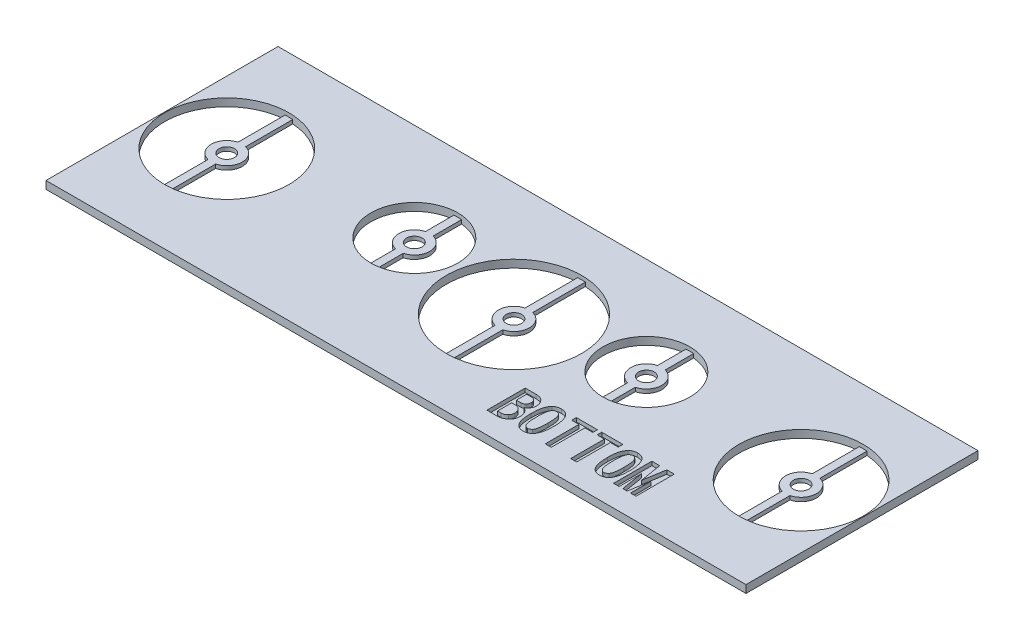
from build123d import *

# Parameters (mm, degrees)
SKETCH2_W           = 181
SKETCH2_H           = 60
SKETCH2_R           = 11.25
SKETCH2_R_2         = 16.08
SKETCH2_R_3         = 17.5
BOSS_EXTRUDE1_DEPTH = 2
BOSS_EXTRUDE2_START = -2
SKETCH3_R           = 2
BOSS_EXTRUDE2_DEPTH = 2
CUT_EXTRUDE1_START  = -1
CUT_EXTRUDE1_DEPTH  = 1
CUT_EXTRUDE2_START  = -1
SKETCH5_R           = 11.25
SKETCH5_R_2         = 16.08
SKETCH5_R_3         = 17.5
CUT_EXTRUDE2_DEPTH  = 1


# Read off the part's stored shape, not the designer's step: Cut-Extrude1
with BuildPart() as part:
    # Sketch2 → Boss-Extrude1 (new body)
    with BuildSketch(Plane(origin=(0, 0, 0), x_dir=(1, 0, 0), z_dir=(0, 1, 0))):
        with Locations((0, -4.75)):
            Rectangle(SKETCH2_W, SKETCH2_H)
        with Locations(Location((-30, 0, 0), (0, 0, 270))):
            Circle(SKETCH2_R, mode=Mode.SUBTRACT)
        with Locations(Location((30, 0, 0), (0, 0, 270))):
            Circle(SKETCH2_R, mode=Mode.SUBTRACT)
        with Locations(Location((-74.25, -4.25, 0), (0, 0, 270))):
            Circle(SKETCH2_R_2, mode=Mode.SUBTRACT)
        with Locations(Location((0, -4.25, 0), (0, 0, 270))):
            Circle(SKETCH2_R_3, mode=Mode.SUBTRACT)
        with Locations(Location((74.25, -4.25, 0), (0, 0, 90))):
            Circle(SKETCH2_R_2, mode=Mode.SUBTRACT)
    extrude(amount=BOSS_EXTRUDE1_DEPTH)

    # Sketch3 → Boss-Extrude2 (add)
    # profile 1 of 5: a face of its own
    with BuildSketch(Plane(origin=(0, 2, 0), x_dir=(1, 0, 0), z_dir=(0, 1, 0)).offset(BOSS_EXTRUDE2_START)):
        with BuildLine():
            Line((-75.25, -20.29887535), (-75.25, -8.122983346))
            ThreePointArc((-75.25, -8.122983346), (-78.25, -4.25), (-75.25, -0.377016654))
            Line((-75.25, -0.377016654), (-75.25, 11.79887535))
            ThreePointArc((-75.25, 11.79887535), (-74.25, 11.83), (-73.25, 11.79887535))
            Line((-73.25, 11.79887535), (-73.25, -0.377016654))
            ThreePointArc((-73.25, -0.377016654), (-70.25, -4.25), (-73.25, -8.122983346))
            Line((-73.25, -8.122983346), (-73.25, -20.29887535))
            ThreePointArc((-73.25, -20.29887535), (-74.25, -20.33), (-75.25, -20.29887535))
        make_face()
        with Locations(Location((-74.25, -4.25, 0), (0, 0, 270))):
            Circle(SKETCH3_R, mode=Mode.SUBTRACT)
    # profile 2 of 5: a face of its own
    with BuildSketch(Plane(origin=(0, 2, 0), x_dir=(1, 0, 0), z_dir=(0, 1, 0)).offset(BOSS_EXTRUDE2_START)):
        with BuildLine():
            Line((73.25, 11.79887535), (73.25, -0.377016654))
            ThreePointArc((73.25, -0.377016654), (70.25, -4.25), (73.25, -8.122983346))
            Line((73.25, -8.122983346), (73.25, -20.29887535))
            ThreePointArc((73.25, -20.29887535), (74.25, -20.33), (75.25, -20.29887535))
            Line((75.25, -20.29887535), (75.25, -8.122983346))
            ThreePointArc((75.25, -8.122983346), (78.25, -4.25), (75.25, -0.377016654))
            Line((75.25, -0.377016654), (75.25, 11.79887535))
            ThreePointArc((75.25, 11.79887535), (74.25, 11.83), (73.25, 11.79887535))
        make_face()
        with Locations(Location((74.25, -4.25, 0), (0, 0, 270))):
            Circle(SKETCH3_R, mode=Mode.SUBTRACT)
    # profile 3 of 5: a face of its own
    with BuildSketch(Plane(origin=(0, 2, 0), x_dir=(1, 0, 0), z_dir=(0, 1, 0)).offset(BOSS_EXTRUDE2_START)):
        with BuildLine():
            Line((-31, 11.205467416), (-31, 3.872983346))
            ThreePointArc((-31, 3.872983346), (-34, 0), (-31, -3.872983346))
            Line((-31, -3.872983346), (-31, -11.205467416))
            ThreePointArc((-31, -11.205467416), (-30, -11.25), (-29, -11.205467416))
            Line((-29, -11.205467416), (-29, -3.872983346))
            ThreePointArc((-29, -3.872983346), (-26, 0), (-29, 3.872983346))
            Line((-29, 3.872983346), (-29, 11.205467416))
            ThreePointArc((-29, 11.205467416), (-30, 11.25), (-31, 11.205467416))
        make_face()
        with Locations(Location((-30, 0, 0), (0, 0, 270))):
            Circle(SKETCH3_R, mode=Mode.SUBTRACT)
    # profile 4 of 5: a face of its own
    with BuildSketch(Plane(origin=(0, 2, 0), x_dir=(1, 0, 0), z_dir=(0, 1, 0)).offset(BOSS_EXTRUDE2_START)):
        with BuildLine():
            Line((29, -11.205467416), (29, -3.872983346))
            ThreePointArc((29, -3.872983346), (26, 0), (29, 3.872983346))
            Line((29, 3.872983346), (29, 11.205467416))
            ThreePointArc((29, 11.205467416), (30, 11.25), (31, 11.205467416))
            Line((31, 11.205467416), (31, 3.872983346))
            ThreePointArc((31, 3.872983346), (34, 0), (31, -3.872983346))
            Line((31, -3.872983346), (31, -11.205467416))
            ThreePointArc((31, -11.205467416), (30, -11.25), (29, -11.205467416))
        make_face()
        with Locations(Location((30, 0, 0), (0, 0, 270))):
            Circle(SKETCH3_R, mode=Mode.SUBTRACT)
    # profile 5 of 5: a face of its own
    with BuildSketch(Plane(origin=(0, 2, 0), x_dir=(1, 0, 0), z_dir=(0, 1, 0)).offset(BOSS_EXTRUDE2_START)):
        with BuildLine():
            Line((-1, 13.22140521), (-1, -0.377016654))
            ThreePointArc((-1, -0.377016654), (-4, -4.25), (-1, -8.122983346))
            Line((-1, -8.122983346), (-1, -21.72140521))
            ThreePointArc((-1, -21.72140521), (0, -21.75), (1, -21.72140521))
            Line((1, -21.72140521), (1, -8.122983346))
            ThreePointArc((1, -8.122983346), (4, -4.25), (1, -0.377016654))
            Line((1, -0.377016654), (1, 13.22140521))
            ThreePointArc((1, 13.22140521), (0, 13.25), (-1, 13.22140521))
        make_face()
        with Locations(Location((0, -4.25, 0), (0, 0, 270))):
            Circle(SKETCH3_R, mode=Mode.SUBTRACT)
    extrude(amount=BOSS_EXTRUDE2_DEPTH)

    # Cut-Extrude1 outline → Cut-Extrude1 (cut)
    # profile 1 of 6: a face of its own
    with BuildSketch(Plane(origin=(0, 2, 0), x_dir=(1, 0, 0), z_dir=(0, 1, 0)).offset(CUT_EXTRUDE1_START)):
        with BuildLine():
            add(Edge.make_bspline(
                [(47.006980667, -19.276596347), (47.098634088, -19.27876699), (47.277526109, -19.28300372), (47.538214081, -19.315468508), (47.785587748, -19.367284932), (48.018908636, -19.442222462), (48.239532457, -19.537103963), (48.443976908, -19.656603341), (48.636551525, -19.794534033), (48.751992232, -19.902448172), (48.810044942, -19.956715928)],
                knots=[0, 0, 0, 0, 0.138875744, 0.271062029, 0.397512175, 0.521399598, 0.641877707, 0.760717596, 0.879669898, 1, 1, 1, 1], degree=3))
            add(Edge.make_bspline(
                [(45.237548679, -19.956715928), (45.29490325, -19.902360387), (45.409288297, -19.793956454), (45.601491586, -19.657177551), (45.803794808, -19.53747293), (46.020630371, -19.442572191), (46.248833986, -19.36724656), (46.490655419, -19.315462071), (46.744520182, -19.28315682), (46.918441384, -19.278809478), (47.006980667, -19.276596347)],
                knots=[0, 0, 0, 0, 0.12160243, 0.242517716, 0.36248895, 0.483198475, 0.606391825, 0.732115136, 0.863625979, 1, 1, 1, 1], degree=3))
            add(Edge.make_bspline(
                [(44.114603986, -24.199989471), (44.115143549, -24.07229899), (44.116199292, -23.82245193), (44.129669047, -23.455479167), (44.151442917, -23.104632008), (44.18389185, -22.769542889), (44.222048744, -22.449655797), (44.271315572, -22.145121992), (44.326189228, -21.855564582), (44.391923041, -21.581927018), (44.465843801, -21.324103696), (44.550657578, -21.082562103), (44.641660818, -20.855637028), (44.741979903, -20.644251721), (44.852963624, -20.449476885), (44.970696136, -20.269175383), (45.096739762, -20.103481962), (45.191136992, -20.005091126), (45.237548679, -19.956715928)],
                knots=[0, 0, 0, 0, 0.085280688, 0.166865447, 0.245229508, 0.320025619, 0.391693201, 0.460355695, 0.526029737, 0.588484097, 0.648252698, 0.705085857, 0.759390436, 0.811488121, 0.861227302, 0.908993012, 0.955255172, 1, 1, 1, 1], degree=3))
            add(Edge.make_bspline(
                [(45.237548679, -28.493711444), (45.191155241, -28.445324045), (45.096795128, -28.346908393), (44.970145656, -28.180992613), (44.853045425, -27.998988008), (44.74194912, -27.802422454), (44.641722074, -27.589136599), (44.550246819, -27.35989353), (44.466282981, -27.115571504), (44.391555381, -26.854881493), (44.326516447, -26.578581527), (44.271087724, -26.286034845), (44.221947936, -25.9777262), (44.183915842, -25.652847649), (44.151449258, -25.312155551), (44.129675105, -24.955706565), (44.116201301, -24.583130763), (44.115144116, -24.329548228), (44.114603986, -24.199989471)],
                knots=[0, 0, 0, 0, 0.044261532, 0.090024007, 0.137618353, 0.187178616, 0.239085164, 0.293184815, 0.350181813, 0.409700177, 0.472280557, 0.537649283, 0.606382972, 0.678501884, 0.753719142, 0.832468783, 0.914406029, 1, 1, 1, 1], degree=3))
            add(Edge.make_bspline(
                [(47.006980667, -29.185041788), (46.918451548, -29.182779619), (46.74455031, -29.178335951), (46.490407438, -29.14670648), (46.248780266, -29.092345625), (46.020461744, -29.015482718), (45.804276554, -28.918157521), (45.600933643, -28.799076813), (45.40872445, -28.660026011), (45.294827341, -28.549363454), (45.237548679, -28.493711444)],
                knots=[0, 0, 0, 0, 0.135998079, 0.267146387, 0.392731079, 0.515886295, 0.636654149, 0.756294658, 0.877441, 1, 1, 1, 1], degree=3))
            add(Edge.make_bspline(
                [(48.810044942, -28.493711444), (48.752066449, -28.549275403), (48.637105049, -28.659449195), (48.444536009, -28.799651932), (48.239055679, -28.918522747), (48.019082086, -29.015842788), (47.78563907, -29.092306834), (47.538457039, -29.146701582), (47.277496098, -29.17848664), (47.098623922, -29.182821083), (47.006980667, -29.185041788)],
                knots=[0, 0, 0, 0, 0.12127018, 0.24045795, 0.358978352, 0.479511833, 0.603356363, 0.729666689, 0.861497608, 1, 1, 1, 1], degree=3))
            add(Edge.make_bspline(
                [(49.970358844, -24.199989471), (49.970020728, -24.327687215), (49.969355791, -24.578817051), (49.952902949, -24.947574897), (49.931597941, -25.300927851), (49.899809516, -25.638694261), (49.858358085, -25.960699314), (49.811283681, -26.26843866), (49.750284437, -26.559682333), (49.68420527, -26.836259127), (49.607518287, -27.097796137), (49.519800221, -27.343173774), (49.424707327, -27.573428391), (49.321805316, -27.788760478), (49.208062338, -27.987470389), (49.086466827, -28.172635802), (48.953923938, -28.340900843), (48.857505182, -28.443305005), (48.810044942, -28.493711444)],
                knots=[0, 0, 0, 0, 0.084135969, 0.165461436, 0.24318319, 0.317383888, 0.388954841, 0.457100989, 0.522456437, 0.584966677, 0.644442095, 0.701946419, 0.756592818, 0.808538802, 0.859086335, 0.907348029, 0.954393886, 1, 1, 1, 1], degree=3))
            add(Edge.make_bspline(
                [(48.810044942, -19.956715928), (48.857403766, -20.007201284), (48.953282616, -20.109409857), (49.087158104, -20.276013335), (49.207372471, -20.460879795), (49.322473408, -20.658175729), (49.423760651, -20.872434542), (49.519935082, -21.099671575), (49.607852298, -21.341916693), (49.683889911, -21.600534461), (49.750349733, -21.873896186), (49.811297705, -22.161419121), (49.85820373, -22.464826975), (49.899967567, -22.782433076), (49.931588122, -23.115865206), (49.952794889, -23.464239428), (49.969400579, -23.827385727), (49.970035233, -24.074159359), (49.970358844, -24.199989471)],
                knots=[0, 0, 0, 0, 0.04610131, 0.093332989, 0.142118715, 0.192855111, 0.245365132, 0.299839374, 0.35718712, 0.416910537, 0.479293624, 0.544546134, 0.612612867, 0.683726495, 0.757906877, 0.835644516, 0.916194981, 1, 1, 1, 1], degree=3))
        make_face()
        with BuildLine():
            add(Edge.make_bspline(
                [(47.006980667, -20.457463312), (46.937751711, -20.462774993), (46.795817176, -20.473665102), (46.586559465, -20.55849381), (46.377590788, -20.688247689), (46.251427999, -20.806256925), (46.184858096, -20.868524598)],
                knots=[0, 0, 0, 0, 0.219996449, 0.451040937, 0.710341286, 1, 1, 1, 1], degree=3))
            add(Edge.make_bspline(
                [(47.862735525, -20.868524598), (47.795621646, -20.806139799), (47.667567474, -20.687108776), (47.452011567, -20.556862012), (47.231549672, -20.473235357), (47.081158131, -20.462672982), (47.006980667, -20.457463312)],
                knots=[0, 0, 0, 0, 0.281718183, 0.53752203, 0.771892469, 1, 1, 1, 1], degree=3))
            add(Edge.make_bspline(
                [(48.471853612, -24.199989471), (48.471710208, -24.089121188), (48.47143142, -23.873585174), (48.463072858, -23.558428279), (48.452757348, -23.259999073), (48.435972405, -22.97715149), (48.413528592, -22.711191535), (48.38722743, -22.46140283), (48.358126851, -22.228196483), (48.322993035, -22.011211665), (48.281446993, -21.811371037), (48.23774313, -21.627608899), (48.186473102, -21.460882273), (48.133457319, -21.30923648), (48.073972384, -21.173958215), (48.008351872, -21.056186614), (47.940175573, -20.953660741), (47.887722036, -20.895994301), (47.862735525, -20.868524598)],
                knots=[0, 0, 0, 0, 0.096568678, 0.187736542, 0.274599489, 0.356664196, 0.4345161, 0.507068854, 0.575436142, 0.639206127, 0.698469211, 0.753206505, 0.803663047, 0.850338009, 0.893083005, 0.932181533, 0.967694327, 1, 1, 1, 1], degree=3))
            add(Edge.make_bspline(
                [(47.862735525, -27.581902774), (47.887804205, -27.554487497), (47.940778532, -27.496554413), (48.007686423, -27.392555136), (48.074590454, -27.274276406), (48.132870369, -27.137818469), (48.187271433, -26.98482007), (48.237266843, -26.815805404), (48.281756506, -26.629158744), (48.322926368, -26.426103318), (48.357944676, -26.206008123), (48.387509532, -25.969121642), (48.413349546, -25.71554659), (48.436083415, -25.44463092), (48.452668462, -25.15741138), (48.463154472, -24.853386196), (48.471398836, -24.53262011), (48.471699478, -24.312725798), (48.471853612, -24.199989471)],
                knots=[0, 0, 0, 0, 0.031847394, 0.06729889, 0.105842776, 0.148470679, 0.194483523, 0.245248819, 0.299729239, 0.35919974, 0.423120901, 0.491048872, 0.564168239, 0.641981695, 0.724483916, 0.81118354, 0.903196795, 1, 1, 1, 1], degree=3))
            add(Edge.make_bspline(
                [(47.006980667, -27.991095599), (47.081138613, -27.985818715), (47.232078707, -27.975078216), (47.452549181, -27.892364607), (47.668333952, -27.762932127), (47.795669474, -27.644355581), (47.862735525, -27.581902774)],
                knots=[0, 0, 0, 0, 0.22829619, 0.464671016, 0.718048818, 1, 1, 1, 1], degree=3))
            add(Edge.make_bspline(
                [(46.184858096, -27.581902774), (46.251381922, -27.644233119), (46.37683005, -27.761773339), (46.585994251, -27.890785276), (46.795299045, -27.974638249), (46.937773467, -27.985715032), (47.006980667, -27.991095599)],
                knots=[0, 0, 0, 0, 0.289911973, 0.546705088, 0.779811201, 1, 1, 1, 1], degree=3))
            add(Edge.make_bspline(
                [(45.613109217, -24.199989471), (45.61327551, -24.313970733), (45.613599958, -24.536354635), (45.62169877, -24.86148844), (45.632765667, -25.169184682), (45.646915323, -25.459559116), (45.668037504, -25.731703145), (45.691395, -25.986668611), (45.721753846, -26.223929692), (45.754910826, -26.443939921), (45.792037808, -26.647279362), (45.834225745, -26.832523451), (45.881820237, -27.000599125), (45.930475735, -27.15186687), (45.987346727, -27.285018155), (46.045920546, -27.401771866), (46.111296069, -27.500375457), (46.161166345, -27.555645682), (46.184858096, -27.581902774)],
                knots=[0, 0, 0, 0, 0.098161738, 0.191519115, 0.280082776, 0.363334657, 0.441870276, 0.515152504, 0.58381315, 0.647839924, 0.706755528, 0.761795503, 0.811382307, 0.857180509, 0.898524695, 0.935949535, 0.9695717, 1, 1, 1, 1], degree=3))
            add(Edge.make_bspline(
                [(46.184858096, -20.868524598), (46.161149116, -20.894772993), (46.111242574, -20.95002491), (46.046477552, -21.048319567), (45.986716405, -21.163850699), (45.931405853, -21.295778392), (45.880903102, -21.445161083), (45.835242417, -21.6106871), (45.791346522, -21.793005992), (45.755213785, -21.992840557), (45.72168191, -22.209658625), (45.691257917, -22.443811079), (45.668248473, -22.695071859), (45.646787111, -22.963451438), (45.632885449, -23.248237539), (45.621633896, -23.550320231), (45.613610404, -23.869229486), (45.613279097, -24.087876761), (45.613109217, -24.199989471)],
                knots=[0, 0, 0, 0, 0.030869207, 0.064978559, 0.10246296, 0.144406224, 0.189836863, 0.240142182, 0.29438996, 0.353624266, 0.417503112, 0.486078991, 0.559881402, 0.637927213, 0.721298548, 0.808970304, 0.902048371, 1, 1, 1, 1], degree=3))
        make_face(mode=Mode.SUBTRACT)
    # profile 2 of 6: a face of its own
    with BuildSketch(Plane(origin=(0, 2, 0), x_dir=(1, 0, 0), z_dir=(0, 1, 0)).offset(CUT_EXTRUDE1_START)):
        with BuildLine():
            add(Edge.make_bspline(
                [(27.276038963, -19.276596347), (27.367692384, -19.27876699), (27.546584405, -19.28300372), (27.807272377, -19.315468508), (28.054646044, -19.367284932), (28.287966932, -19.442222462), (28.508590753, -19.537103963), (28.713035204, -19.656603341), (28.905609821, -19.794534033), (29.021050528, -19.902448172), (29.079103238, -19.956715928)],
                knots=[0, 0, 0, 0, 0.138875744, 0.271062029, 0.397512175, 0.521399598, 0.641877707, 0.760717596, 0.879669898, 1, 1, 1, 1], degree=3))
            add(Edge.make_bspline(
                [(25.506606975, -19.956715928), (25.563961546, -19.902360387), (25.678346593, -19.793956454), (25.870549882, -19.657177551), (26.072853104, -19.53747293), (26.289688667, -19.442572191), (26.517892282, -19.36724656), (26.759713715, -19.315462071), (27.013578478, -19.28315682), (27.18749968, -19.278809478), (27.276038963, -19.276596347)],
                knots=[0, 0, 0, 0, 0.12160243, 0.242517716, 0.36248895, 0.483198475, 0.606391825, 0.732115136, 0.863625979, 1, 1, 1, 1], degree=3))
            add(Edge.make_bspline(
                [(24.383662281, -24.199989471), (24.384201845, -24.07229899), (24.385257588, -23.82245193), (24.398727343, -23.455479167), (24.420501213, -23.104632008), (24.452950145, -22.769542889), (24.49110704, -22.449655797), (24.540373868, -22.145121992), (24.595247524, -21.855564582), (24.660981337, -21.581927018), (24.734902097, -21.324103696), (24.819715874, -21.082562103), (24.910719114, -20.855637028), (25.011038199, -20.644251721), (25.12202192, -20.449476885), (25.239754432, -20.269175383), (25.365798058, -20.103481962), (25.460195288, -20.005091126), (25.506606975, -19.956715928)],
                knots=[0, 0, 0, 0, 0.085280688, 0.166865447, 0.245229508, 0.320025619, 0.391693201, 0.460355695, 0.526029737, 0.588484097, 0.648252698, 0.705085857, 0.759390436, 0.811488121, 0.861227302, 0.908993012, 0.955255172, 1, 1, 1, 1], degree=3))
            add(Edge.make_bspline(
                [(25.506606975, -28.493711444), (25.460213537, -28.445324045), (25.365853424, -28.346908393), (25.239203952, -28.180992613), (25.122103721, -27.998988008), (25.011007416, -27.802422454), (24.91078037, -27.589136599), (24.819305115, -27.35989353), (24.735341277, -27.115571504), (24.660613677, -26.854881493), (24.595574743, -26.578581527), (24.54014602, -26.286034845), (24.491006232, -25.9777262), (24.452974138, -25.652847649), (24.420507554, -25.312155551), (24.398733401, -24.955706565), (24.385259596, -24.583130763), (24.384202412, -24.329548228), (24.383662281, -24.199989471)],
                knots=[0, 0, 0, 0, 0.044261532, 0.090024007, 0.137618353, 0.187178616, 0.239085164, 0.293184815, 0.350181813, 0.409700177, 0.472280557, 0.537649283, 0.606382972, 0.678501884, 0.753719142, 0.832468783, 0.914406029, 1, 1, 1, 1], degree=3))
            add(Edge.make_bspline(
                [(27.276038963, -29.185041788), (27.187509844, -29.182779619), (27.013608606, -29.178335951), (26.759465734, -29.14670648), (26.517838562, -29.092345625), (26.28952004, -29.015482718), (26.07333485, -28.918157521), (25.869991939, -28.799076813), (25.677782746, -28.660026011), (25.563885637, -28.549363454), (25.506606975, -28.493711444)],
                knots=[0, 0, 0, 0, 0.135998079, 0.267146387, 0.392731079, 0.515886295, 0.636654149, 0.756294658, 0.877441, 1, 1, 1, 1], degree=3))
            add(Edge.make_bspline(
                [(29.079103238, -28.493711444), (29.021124745, -28.549275403), (28.906163345, -28.659449195), (28.713594305, -28.799651932), (28.508113974, -28.918522747), (28.288140382, -29.015842788), (28.054697366, -29.092306834), (27.807515335, -29.146701582), (27.546554394, -29.17848664), (27.367682218, -29.182821083), (27.276038963, -29.185041788)],
                knots=[0, 0, 0, 0, 0.12127018, 0.24045795, 0.358978352, 0.479511833, 0.603356363, 0.729666689, 0.861497608, 1, 1, 1, 1], degree=3))
            add(Edge.make_bspline(
                [(30.239417139, -24.199989471), (30.239079024, -24.327687215), (30.238414087, -24.578817051), (30.221961245, -24.947574897), (30.200656237, -25.300927851), (30.168867812, -25.638694261), (30.127416381, -25.960699314), (30.080341977, -26.26843866), (30.019342733, -26.559682333), (29.953263566, -26.836259127), (29.876576583, -27.097796137), (29.788858517, -27.343173774), (29.693765623, -27.573428391), (29.590863612, -27.788760478), (29.477120634, -27.987470389), (29.355525123, -28.172635802), (29.222982234, -28.340900843), (29.126563478, -28.443305005), (29.079103238, -28.493711444)],
                knots=[0, 0, 0, 0, 0.084135969, 0.165461436, 0.24318319, 0.317383888, 0.388954841, 0.457100989, 0.522456437, 0.584966677, 0.644442095, 0.701946419, 0.756592818, 0.808538802, 0.859086335, 0.907348029, 0.954393886, 1, 1, 1, 1], degree=3))
            add(Edge.make_bspline(
                [(29.079103238, -19.956715928), (29.126462062, -20.007201284), (29.222340912, -20.109409857), (29.3562164, -20.276013335), (29.476430767, -20.460879795), (29.591531704, -20.658175729), (29.692818947, -20.872434542), (29.788993378, -21.099671575), (29.876910594, -21.341916693), (29.952948207, -21.600534461), (30.019408029, -21.873896186), (30.080356001, -22.161419121), (30.127262025, -22.464826975), (30.169025863, -22.782433076), (30.200646418, -23.115865206), (30.221853185, -23.464239428), (30.238458875, -23.827385727), (30.239093529, -24.074159359), (30.239417139, -24.199989471)],
                knots=[0, 0, 0, 0, 0.04610131, 0.093332989, 0.142118715, 0.192855111, 0.245365132, 0.299839374, 0.35718712, 0.416910537, 0.479293624, 0.544546134, 0.612612867, 0.683726495, 0.757906877, 0.835644516, 0.916194981, 1, 1, 1, 1], degree=3))
        make_face()
        with BuildLine():
            add(Edge.make_bspline(
                [(27.276038963, -20.457463312), (27.206810007, -20.462774993), (27.064875472, -20.473665102), (26.855617761, -20.55849381), (26.646649084, -20.688247689), (26.520486295, -20.806256925), (26.453916392, -20.868524598)],
                knots=[0, 0, 0, 0, 0.219996449, 0.451040937, 0.710341286, 1, 1, 1, 1], degree=3))
            add(Edge.make_bspline(
                [(28.131793821, -20.868524598), (28.064679942, -20.806139799), (27.93662577, -20.687108776), (27.721069863, -20.556862012), (27.500607968, -20.473235357), (27.350216427, -20.462672982), (27.276038963, -20.457463312)],
                knots=[0, 0, 0, 0, 0.281718183, 0.53752203, 0.771892469, 1, 1, 1, 1], degree=3))
            add(Edge.make_bspline(
                [(28.740911908, -24.199989471), (28.740768504, -24.089121188), (28.740489716, -23.873585174), (28.732131154, -23.558428279), (28.721815644, -23.259999073), (28.705030701, -22.97715149), (28.682586888, -22.711191535), (28.656285726, -22.46140283), (28.627185147, -22.228196483), (28.592051331, -22.011211665), (28.550505289, -21.811371037), (28.506801425, -21.627608899), (28.455531398, -21.460882273), (28.402515615, -21.30923648), (28.34303068, -21.173958215), (28.277410168, -21.056186614), (28.209233869, -20.953660741), (28.156780332, -20.895994301), (28.131793821, -20.868524598)],
                knots=[0, 0, 0, 0, 0.096568678, 0.187736542, 0.274599489, 0.356664196, 0.4345161, 0.507068854, 0.575436142, 0.639206127, 0.698469211, 0.753206505, 0.803663047, 0.850338009, 0.893083005, 0.932181533, 0.967694327, 1, 1, 1, 1], degree=3))
            add(Edge.make_bspline(
                [(28.131793821, -27.581902774), (28.156862501, -27.554487497), (28.209836828, -27.496554413), (28.276744719, -27.392555136), (28.34364875, -27.274276406), (28.401928665, -27.137818469), (28.456329729, -26.98482007), (28.506325139, -26.815805404), (28.550814802, -26.629158744), (28.591984664, -26.426103318), (28.627002972, -26.206008123), (28.656567828, -25.969121642), (28.682407842, -25.71554659), (28.705141711, -25.44463092), (28.721726758, -25.15741138), (28.732212768, -24.853386196), (28.740457132, -24.53262011), (28.740757774, -24.312725798), (28.740911908, -24.199989471)],
                knots=[0, 0, 0, 0, 0.031847394, 0.06729889, 0.105842776, 0.148470679, 0.194483523, 0.245248819, 0.299729239, 0.35919974, 0.423120901, 0.491048872, 0.564168239, 0.641981695, 0.724483916, 0.81118354, 0.903196795, 1, 1, 1, 1], degree=3))
            add(Edge.make_bspline(
                [(27.276038963, -27.991095599), (27.350196909, -27.985818715), (27.501137003, -27.975078216), (27.721607477, -27.892364607), (27.937392248, -27.762932127), (28.06472777, -27.644355581), (28.131793821, -27.581902774)],
                knots=[0, 0, 0, 0, 0.22829619, 0.464671016, 0.718048818, 1, 1, 1, 1], degree=3))
            add(Edge.make_bspline(
                [(26.453916392, -27.581902774), (26.520440218, -27.644233119), (26.645888346, -27.761773339), (26.855052547, -27.890785276), (27.06435734, -27.974638249), (27.206831763, -27.985715032), (27.276038963, -27.991095599)],
                knots=[0, 0, 0, 0, 0.289911973, 0.546705088, 0.779811201, 1, 1, 1, 1], degree=3))
            add(Edge.make_bspline(
                [(25.882167513, -24.199989471), (25.882333806, -24.313970733), (25.882658254, -24.536354635), (25.890757066, -24.86148844), (25.901823963, -25.169184682), (25.915973619, -25.459559116), (25.9370958, -25.731703145), (25.960453296, -25.986668611), (25.990812142, -26.223929692), (26.023969122, -26.443939921), (26.061096104, -26.647279362), (26.103284041, -26.832523451), (26.150878533, -27.000599125), (26.199534031, -27.15186687), (26.256405023, -27.285018155), (26.314978842, -27.401771866), (26.380354365, -27.500375457), (26.430224641, -27.555645682), (26.453916392, -27.581902774)],
                knots=[0, 0, 0, 0, 0.098161738, 0.191519115, 0.280082776, 0.363334657, 0.441870276, 0.515152504, 0.58381315, 0.647839924, 0.706755528, 0.761795503, 0.811382307, 0.857180509, 0.898524695, 0.935949535, 0.9695717, 1, 1, 1, 1], degree=3))
            add(Edge.make_bspline(
                [(26.453916392, -20.868524598), (26.430207412, -20.894772993), (26.38030087, -20.95002491), (26.315535848, -21.048319567), (26.255774701, -21.163850699), (26.200464149, -21.295778392), (26.149961398, -21.445161083), (26.104300713, -21.6106871), (26.060404818, -21.793005992), (26.024272081, -21.992840557), (25.990740206, -22.209658625), (25.960316213, -22.443811079), (25.937306769, -22.695071859), (25.915845407, -22.963451438), (25.901943745, -23.248237539), (25.890692192, -23.550320231), (25.8826687, -23.869229486), (25.882337393, -24.087876761), (25.882167513, -24.199989471)],
                knots=[0, 0, 0, 0, 0.030869207, 0.064978559, 0.10246296, 0.144406224, 0.189836863, 0.240142182, 0.29438996, 0.353624266, 0.417503112, 0.486078991, 0.559881402, 0.637927213, 0.721298548, 0.808970304, 0.902048371, 1, 1, 1, 1], degree=3))
        make_face(mode=Mode.SUBTRACT)
    # profile 3 of 6: a face of its own
    with BuildSketch(Plane(origin=(0, 2, 0), x_dir=(1, 0, 0), z_dir=(0, 1, 0)).offset(CUT_EXTRUDE1_START)):
        with BuildLine():
            add(Edge.make_bspline(
                [(20.699058395, -19.276596347), (20.801908314, -19.278080497), (21.001223914, -19.280956672), (21.289709717, -19.31184722), (21.558730169, -19.359364867), (21.808066568, -19.427988071), (22.037213032, -19.517839157), (22.245861259, -19.626623802), (22.436165128, -19.753599019), (22.546335162, -19.855544016), (22.601151071, -19.906267498)],
                knots=[0, 0, 0, 0, 0.15002436, 0.290736207, 0.422828321, 0.548291761, 0.66744098, 0.781261559, 0.891165084, 1, 1, 1, 1], degree=3))
            Line((20.699058395, -19.276596347), (17.950553163, -19.276596347))
            Line((17.950553163, -19.276596347), (17.950553163, -29.185041788))
            Line((17.950553163, -29.185041788), (20.600029995, -29.185041788))
            add(Edge.make_bspline(
                [(22.946816243, -28.196626242), (22.864857234, -28.275562101), (22.703795796, -28.430682607), (22.439389195, -28.631260662), (22.163741023, -28.802585337), (21.875279456, -28.943261666), (21.57413946, -29.052858632), (21.260082011, -29.128511162), (20.93414431, -29.177253386), (20.712313541, -29.182424392), (20.600029995, -29.185041788)],
                knots=[0, 0, 0, 0, 0.130308014, 0.256074304, 0.379470962, 0.501729134, 0.623199323, 0.745933667, 0.871399856, 1, 1, 1, 1], degree=3))
            add(Edge.make_bspline(
                [(23.662436571, -26.229137453), (23.660414873, -26.330757634), (23.656471401, -26.528975243), (23.621930789, -26.818368875), (23.566936322, -27.091254701), (23.488305148, -27.347395761), (23.386757565, -27.58559227), (23.265187911, -27.808317344), (23.119180165, -28.013770814), (23.004342528, -28.135598427), (22.946816243, -28.196626242)],
                knots=[0, 0, 0, 0, 0.141731796, 0.276458253, 0.405972813, 0.529654494, 0.649570221, 0.766631162, 0.883097191, 1, 1, 1, 1], degree=3))
            add(Edge.make_bspline(
                [(22.946816243, -24.362545525), (23.00428842, -24.42298346), (23.118638964, -24.543234879), (23.264210676, -24.744419151), (23.385919736, -24.959425354), (23.488071586, -25.186711198), (23.566152087, -25.428684831), (23.621911251, -25.68397173), (23.65633951, -25.952287953), (23.660376815, -26.135610008), (23.662436571, -26.229137453)],
                knots=[0, 0, 0, 0, 0.121728698, 0.24219968, 0.361593958, 0.482147365, 0.605577795, 0.732287658, 0.863418226, 1, 1, 1, 1], degree=3))
            add(Edge.make_bspline(
                [(22.126562132, -23.826297393), (22.206455627, -23.862105112), (22.362340765, -23.931971767), (22.578139867, -24.06089214), (22.774225528, -24.202025915), (22.889918712, -24.309627444), (22.946816243, -24.362545525)],
                knots=[0, 0, 0, 0, 0.26626392, 0.519523995, 0.76370347, 1, 1, 1, 1], degree=3))
            add(Edge.make_bspline(
                [(22.799207872, -23.344234613), (22.764021941, -23.37944366), (22.696727369, -23.446782443), (22.595748137, -23.537707965), (22.502522183, -23.617394497), (22.41434808, -23.682385518), (22.333763602, -23.737363098), (22.260300529, -23.781003219), (22.191602867, -23.810314991), (22.147274585, -23.82120774), (22.126562132, -23.826297393)],
                knots=[0, 0, 0, 0, 0.178387857, 0.341174275, 0.486952761, 0.617776026, 0.73356334, 0.836571746, 0.923637917, 1, 1, 1, 1], degree=3))
            add(Edge.make_bspline(
                [(23.41393134, -21.772859426), (23.412410641, -21.850825992), (23.40941833, -22.004242508), (23.377808783, -22.227839825), (23.332172086, -22.441646196), (23.264384375, -22.644612958), (23.176511201, -22.836438847), (23.070718326, -23.018320786), (22.945789986, -23.189132014), (22.848309246, -23.292279088), (22.799207872, -23.344234613)],
                knots=[0, 0, 0, 0, 0.134836817, 0.265321354, 0.390061564, 0.51276418, 0.634792731, 0.754582565, 0.876382419, 1, 1, 1, 1], degree=3))
            add(Edge.make_bspline(
                [(22.601151071, -19.906267498), (22.66605968, -19.974200511), (22.793318685, -20.107389126), (22.95763993, -20.324390185), (23.099382933, -20.5467156), (23.213574935, -20.778236034), (23.304031801, -21.015776534), (23.368167549, -21.261247645), (23.406066153, -21.514446197), (23.41129253, -21.686160471), (23.41393134, -21.772859426)],
                knots=[0, 0, 0, 0, 0.134680326, 0.264052558, 0.389722442, 0.512383834, 0.63368088, 0.753731106, 0.875658237, 1, 1, 1, 1], degree=3))
        make_face()
        with BuildLine():
            add(Edge.make_bspline(
                [(21.702421624, -24.880109052), (21.656374755, -24.836374457), (21.567565963, -24.752025255), (21.427342013, -24.641467107), (21.290127089, -24.544908831), (21.150783535, -24.467915591), (21.012459037, -24.407964191), (20.875086367, -24.363500183), (20.737288891, -24.339134168), (20.64558013, -24.334801914), (20.600029995, -24.332650158)],
                knots=[0, 0, 0, 0, 0.150867683, 0.29097259, 0.424017144, 0.549255561, 0.668607296, 0.781911688, 0.891679353, 1, 1, 1, 1], degree=3))
            add(Edge.make_bspline(
                [(22.21437977, -26.229137453), (22.213126265, -26.160561926), (22.210679192, -26.026689952), (22.186322134, -25.831339997), (22.143892832, -25.647531876), (22.091360646, -25.471696006), (22.017369111, -25.307692132), (21.929660928, -25.152946855), (21.824168463, -25.009912511), (21.743172194, -24.923556299), (21.702421624, -24.880109052)],
                knots=[0, 0, 0, 0, 0.13871828, 0.27080346, 0.397380984, 0.520149546, 0.641454007, 0.760565242, 0.87953639, 1, 1, 1, 1], degree=3))
            add(Edge.make_bspline(
                [(21.752870054, -27.432425943), (21.790012741, -27.393412714), (21.863799365, -27.315910124), (21.955996358, -27.185154677), (22.039027373, -27.048686797), (22.1003881, -26.900325275), (22.152205994, -26.745118426), (22.189708203, -26.581321284), (22.209721943, -26.407765118), (22.212803196, -26.289599067), (22.21437977, -26.229137453)],
                knots=[0, 0, 0, 0, 0.121885878, 0.242135078, 0.361695022, 0.483065143, 0.604893822, 0.732244969, 0.86299871, 1, 1, 1, 1], degree=3))
            add(Edge.make_bspline(
                [(20.401973193, -27.991095599), (20.466838816, -27.989231761), (20.59461084, -27.985560381), (20.782290219, -27.958563609), (20.963417477, -27.91587426), (21.136898739, -27.854272625), (21.302825272, -27.774339677), (21.46236902, -27.679799196), (21.612743954, -27.564187703), (21.705637983, -27.47683866), (21.752870054, -27.432425943)],
                knots=[0, 0, 0, 0, 0.129535789, 0.255159035, 0.377972511, 0.50074187, 0.622052731, 0.745375561, 0.870535924, 1, 1, 1, 1], degree=3))
            Line((20.401973193, -27.991095599), (19.503243746, -27.991095599))
            Line((19.503243746, -27.991095599), (19.503243746, -24.332650158))
            Line((19.503243746, -24.332650158), (20.600029995, -24.332650158))
        make_face(mode=Mode.SUBTRACT)
        with BuildLine():
            add(Edge.make_bspline(
                [(21.702421624, -20.868524598), (21.636265535, -20.808375643), (21.511427847, -20.69487352), (21.307041901, -20.566942873), (21.102343808, -20.485593428), (20.963781972, -20.47543169), (20.897115196, -20.470542535)],
                knots=[0, 0, 0, 0, 0.291023761, 0.549166891, 0.783088979, 1, 1, 1, 1], degree=3))
            add(Edge.make_bspline(
                [(22.016322969, -21.772859426), (22.013658956, -21.679592263), (22.008606628, -21.502710125), (21.94612497, -21.255942443), (21.852242945, -21.038073795), (21.7517213, -20.924315859), (21.702421624, -20.868524598)],
                knots=[0, 0, 0, 0, 0.284151835, 0.53889689, 0.773857325, 1, 1, 1, 1], degree=3))
            add(Edge.make_bspline(
                [(21.603393223, -22.778091115), (21.636416831, -22.743152024), (21.701200015, -22.674611194), (21.786545077, -22.563117281), (21.857547408, -22.445102097), (21.915318048, -22.321609238), (21.961406322, -22.192897516), (21.991816228, -22.057922628), (22.014299615, -21.917475709), (22.015641959, -21.82153363), (22.016322969, -21.772859426)],
                knots=[0, 0, 0, 0, 0.129066104, 0.253191991, 0.376265128, 0.498242028, 0.618869418, 0.742622774, 0.869425056, 1, 1, 1, 1], degree=3))
            add(Edge.make_bspline(
                [(20.749506826, -23.13870397), (20.829759736, -23.13466937), (20.98702457, -23.126763107), (21.213619535, -23.055506854), (21.423058247, -22.940466689), (21.542417542, -22.832994281), (21.603393223, -22.778091115)],
                knots=[0, 0, 0, 0, 0.252537423, 0.494876204, 0.74195334, 1, 1, 1, 1], degree=3))
            Line((20.749506826, -23.13870397), (19.503243746, -23.13870397))
            Line((19.503243746, -23.13870397), (19.503243746, -20.470542535))
            Line((19.503243746, -20.470542535), (20.897115196, -20.470542535))
        make_face(mode=Mode.SUBTRACT)
    # profile 4 of 6: a face of its own
    with BuildSketch(Plane(origin=(0, 2, 0), x_dir=(1, 0, 0), z_dir=(0, 1, 0)).offset(CUT_EXTRUDE1_START)):
        Polygon((52.139641355, -23.423203505), (53.085082311, -29.185041788), (54.198684703, -29.185041788), (55.063781863, -23.912845888), (55.063781863, -29.185041788), (56.496890981, -29.185041788), (56.496890981, -19.276596347), (54.57050832, -19.276596347), (53.642717851, -24.893399799), (52.713258694, -19.276596347), (50.706532237, -19.276596347), (50.706532237, -29.185041788), (52.139641355, -29.185041788), align=None)
    # profile 5 of 6: a face of its own
    with BuildSketch(Plane(origin=(0, 2, 0), x_dir=(1, 0, 0), z_dir=(0, 1, 0)).offset(CUT_EXTRUDE1_START)):
        Polygon((39.611614449, -29.185041788), (41.164305032, -29.185041788), (41.164305032, -20.470542535), (43.195321474, -20.470542535), (43.195321474, -19.276596347), (37.735680219, -19.276596347), (37.735680219, -20.470542535), (39.611614449, -20.470542535), align=None)
    # profile 6 of 6: a face of its own
    with BuildSketch(Plane(origin=(0, 2, 0), x_dir=(1, 0, 0), z_dir=(0, 1, 0)).offset(CUT_EXTRUDE1_START)):
        Polygon((33.034633881, -29.185041788), (34.587324464, -29.185041788), (34.587324464, -20.470542535), (36.618340906, -20.470542535), (36.618340906, -19.276596347), (31.158699651, -19.276596347), (31.158699651, -20.470542535), (33.034633881, -20.470542535), align=None)
    extrude(amount=CUT_EXTRUDE1_DEPTH, mode=Mode.SUBTRACT)

    # Sketch5 → Cut-Extrude2 (cut)
    with BuildSketch(Plane(origin=(0, 2, 0), x_dir=(1, 0, 0), z_dir=(0, 1, 0)).offset(CUT_EXTRUDE2_START)):
        with Locations(Location((30, 0, 0), (0, 0, 95.099688914))):
            Circle(SKETCH5_R)
        with Locations(Location((-30, 0, 0), (0, 0, 84.900311086))):
            Circle(SKETCH5_R)
        with Locations(Location((-74.25, -4.25, 0), (0, 0, 93.565471122))):
            Circle(SKETCH5_R_2)
        with Locations(Location((74.25, -4.25, 0), (0, 0, 90))):
            Circle(SKETCH5_R_2)
        with Locations(Location((0, -4.25, 0), (0, 0, 86.72417104))):
            Circle(SKETCH5_R_3)
    extrude(amount=CUT_EXTRUDE2_DEPTH, mode=Mode.SUBTRACT)


solid = part.part
